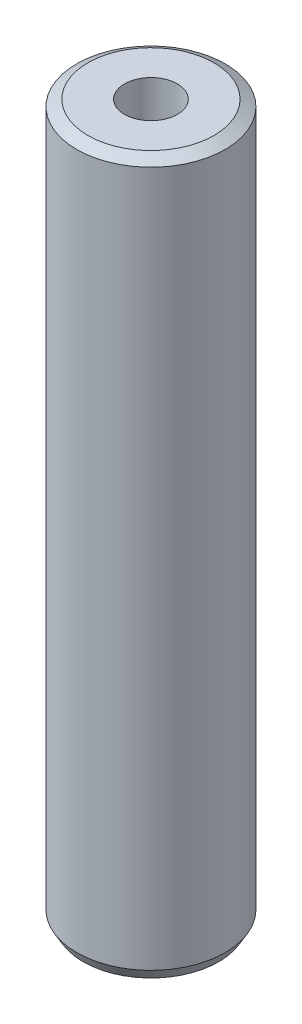
from build123d import *
from OCP.BRepFilletAPI import BRepFilletAPI_MakeChamfer

# Parameters (mm, degrees)
SKETCH1_R           = 12.5
BOSS_EXTRUDE1_DEPTH = 120.063627585
SKETCH2_R           = 4.451437491
CUT_EXTRUDE1_DEPTH  = 122.35804328
CHAMFER1_SIZE       = 1.091757753
CHAMFER1_SIZE2      = 1.890979898


with BuildPart() as part:
    # Sketch1 → Boss-Extrude1 (new body)
    with BuildSketch(Plane(origin=(0, 0, 0), x_dir=(1, 0, 0), z_dir=(0, 1, 0))):
        Circle(SKETCH1_R)
    extrude(amount=BOSS_EXTRUDE1_DEPTH)

    # Sketch2 → Cut-Extrude1 (cut, through all)
    with BuildSketch(Plane(origin=(0, 0, 0), x_dir=(1, 0, 0), z_dir=(0, 1, 0))):
        Circle(SKETCH2_R)
    extrude(amount=CUT_EXTRUDE1_DEPTH, mode=Mode.SUBTRACT)

    # Chamfer1: one chamfer whose edges measure the first distance from different faces: ONE call of the kernel's chamfer builder (chamfer() names one face for all edges)
    chamfer1_edges_1 = [part.edges().sort_by_distance(p)[0] for p in [
        (-12.5, 120.063627585, 0),
    ]]
    chamfer1_side_1 = [part.faces().sort_by_distance(p)[0] for p in [
        (-12.5, 60.031813792, 0),
    ]]
    chamfer1_edges_2 = [part.edges().sort_by_distance(p)[0] for p in [
        (-12.5, 0, 0),
    ]]
    chamfer1_side_2 = [part.faces().sort_by_distance(p)[0] for p in [
        (-12.146446609, 0, 0),
    ]]
    chamfer1 = BRepFilletAPI_MakeChamfer(part.part.solid().wrapped)
    for e in chamfer1_edges_1:
        chamfer1.Add(CHAMFER1_SIZE, CHAMFER1_SIZE2, e.wrapped, chamfer1_side_1[0].wrapped)  # the first distance lies on this face
    for e in chamfer1_edges_2:
        chamfer1.Add(CHAMFER1_SIZE, CHAMFER1_SIZE2, e.wrapped, chamfer1_side_2[0].wrapped)  # the first distance lies on this face
    add(Compound.cast(chamfer1.Shape()), mode=Mode.REPLACE)


solid = part.part
